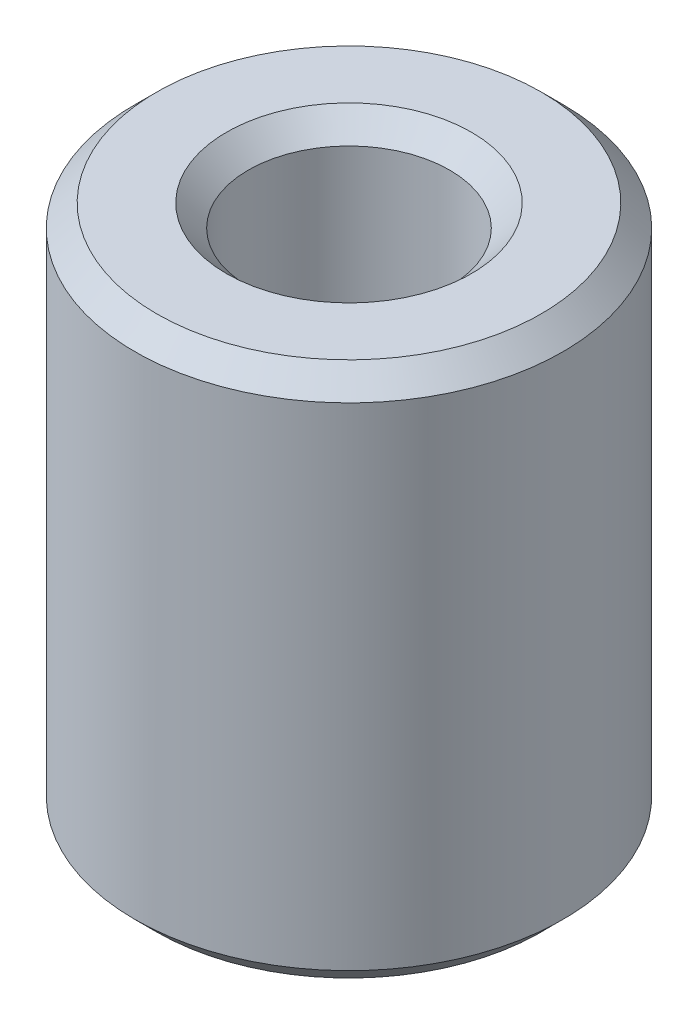
from build123d import *

# Parameters (mm, degrees)
SKETCH1_R           = 5
BOSS_EXTRUDE1_DEPTH = 12.505386945
SKETCH2_R           = 2.351400549
CUT_EXTRUDE1_DEPTH  = 15.366095595
CHAMFER1_SIZE       = 0.51019785


with BuildPart() as part:
    # Sketch1 → Boss-Extrude1 (new body)
    with BuildSketch(Plane(origin=(0, 0, 0), x_dir=(1, 0, 0), z_dir=(0, 1, 0))):
        Circle(SKETCH1_R)
    extrude(amount=BOSS_EXTRUDE1_DEPTH)

    # Sketch2 → Cut-Extrude1 (cut, through all)
    with BuildSketch(Plane(origin=(0, 0, 0), x_dir=(1, 0, 0), z_dir=(0, 1, 0))):
        Circle(SKETCH2_R)
    extrude(amount=CUT_EXTRUDE1_DEPTH, mode=Mode.SUBTRACT)

    # Chamfer1
    chamfer1_edges = [part.edges().sort_by_distance(p)[0] for p in [
        (-2.351400549, 12.505386945, 0),
        (-2.351400549, 0, 0),
        (-5, 0, 0),
        (-5, 12.505386945, 0),
    ]]
    chamfer(chamfer1_edges, length=CHAMFER1_SIZE)


solid = part.part
